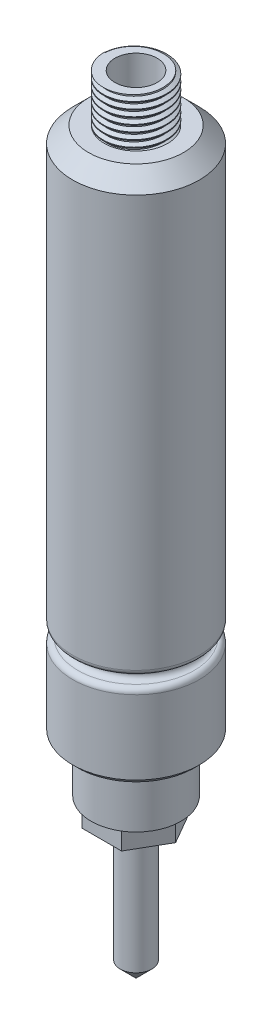
from build123d import *

# Parameters (mm, degrees)
SKETCH1_R           = 12
BOSS_EXTRUDE1_DEPTH = 90
SKETCH2_R           = 12
SKETCH2_R_2         = 8.5
CUT_EXTRUDE1_DEPTH  = 10
SKETCH3_W           = 2
SKETCH3_H           = 2
SKETCH4_R           = 12
BOSS_EXTRUDE2_DEPTH = 20
SKETCH5_R           = 3
BOSS_EXTRUDE3_DEPTH = 30
CHAMFER1_SIZE       = 3
SKETCH6_R           = 6
BOSS_EXTRUDE4_DEPTH = 10
THREAD1_PITCH       = 1.25
CUT_EXTRUDE2_START  = -1
SKETCH15_R          = 6
CUT_EXTRUDE2_DEPTH  = 1
CHAMFER2_SIZE       = 1
SKETCH16_R          = 3
BOSS_EXTRUDE5_DEPTH = 4
FILLET1_R           = 1
FILLET2_R           = 1
SKETCH17_R          = 4
CUT_EXTRUDE3_DEPTH  = 119
FILLET3_R           = 3
SKETCH18_R          = 0.13
CUT_EXTRUDE4_DEPTH  = 50
CUT_EXTRUDE5_START  = -18
SKETCH20_R          = 0.13
CUT_EXTRUDE5_DEPTH  = 18
CUT_EXTRUDE6_START  = -60
CUT_EXTRUDE6_DEPTH  = 60
BOSS_EXTRUDE6_START = -20
BOSS_EXTRUDE6_DEPTH = 20
CHAMFER3_SIZE       = 3


with BuildPart() as part:
    # Sketch1 → Boss-Extrude1 (new body)
    with BuildSketch(Plane(origin=(0, 0, 0), x_dir=(1, 0, 0), z_dir=(0, 1, 0))):
        with Locations(Location((0, 0, 0), (0, 0, 90))):
            Circle(SKETCH1_R)
    extrude(amount=BOSS_EXTRUDE1_DEPTH)

    # Sketch2 → Cut-Extrude1 (cut)
    with BuildSketch(Plane.XZ):
        with Locations(Location((0, 0, 0), (0, 0, 270))):
            Circle(SKETCH2_R)
        with Locations(Location((0, 0, 0), (0, 0, 270))):
            Circle(SKETCH2_R_2, mode=Mode.SUBTRACT)
    extrude(amount=-CUT_EXTRUDE1_DEPTH, mode=Mode.SUBTRACT)

    # Sketch3 → Cut-Revolve1 (revolve, cut)
    with BuildSketch(Plane(origin=(0, 0, 0), x_dir=(0, 0, -1), z_dir=(1, 0, 0)), mode=Mode.PRIVATE) as cut_revolve1_sk:
        with Locations((-11, 27)):
            Rectangle(SKETCH3_W, SKETCH3_H)
    revolve(cut_revolve1_sk.sketch.rotate(Axis((0, 90, 0), (0, -1, 0)), 180), axis=Axis((0, 90, 0), (0, -1, 0)), mode=Mode.SUBTRACT)

    # Sketch4 → Boss-Extrude2 (add)
    with BuildSketch(Plane(origin=(0, 90, 0), x_dir=(1, 0, 0), z_dir=(0, 1, 0))):
        with Locations(Location((0, 0, 0), (0, 0, 90))):
            Circle(SKETCH4_R)
    extrude(amount=BOSS_EXTRUDE2_DEPTH)

    # Sketch5 → Boss-Extrude3 (add)
    with BuildSketch(Plane.XZ):
        with Locations(Location((0, 0, 0), (0, 0, 270))):
            Circle(SKETCH5_R)
    extrude(amount=BOSS_EXTRUDE3_DEPTH)

    # Chamfer1
    chamfer1_edges = [part.edges().sort_by_distance(p)[0] for p in [
        (0, -30, 3),
    ]]
    chamfer(chamfer1_edges, length=CHAMFER1_SIZE)

    # Sketch6 → Boss-Extrude4 (add)
    with BuildSketch(Plane(origin=(0, 110, 0), x_dir=(1, 0, 0), z_dir=(0, 1, 0))):
        with Locations(Location((0, 0, 0), (0, 0, 270))):
            Circle(SKETCH6_R)
    extrude(amount=BOSS_EXTRUDE4_DEPTH)

    # Thread1: the profile of Thread Profile2 profile screwed along a right-hand helix of 8 turns, 8 arcs to a turn; built about Z, then put on its axis
    thread1_z = Axis((0, 0, 0), (0, 0, 1))
    thread1_corners = [(6.0003, 0, -0.000173205), (6.0003, 0, 1.093923202), (5.323417656, 0, 0.703124998), (5.323417656, 0, 0.390624998)]
    with BuildLine(mode=Mode.PRIVATE) as thread1_profile:
        Line(thread1_corners[0], thread1_corners[1])
        Line(thread1_corners[1], thread1_corners[2])
        Line(thread1_corners[2], thread1_corners[3])
        Line(thread1_corners[3], thread1_corners[0])
    thread1_cap = Face(thread1_profile.wire())
    thread1_turn_angles = [0, 22.5, 45, 67.5, 90, 112.5, 135, 157.5, 180, 202.5, 225, 247.5, 270, 292.5, 315, 337.5, 360]
    thread1_turn_weights = [1, 0.9238795325112867, 1, 0.9238795325112867, 1, 0.9238795325112867, 1, 0.9238795325112867, 1, 0.9238795325112867, 1, 0.9238795325112867, 1, 0.9238795325112867, 1, 0.9238795325112867, 1]
    thread1_turn_rails = [Edge.make_bspline([Vector(p[0], p[1], 0).rotate(thread1_z, thread1_turn_angles[k]) / thread1_turn_weights[k] + Vector(0, 0, p[2] + THREAD1_PITCH * thread1_turn_angles[k] / 360) for k in range(17)], [0, 0, 0, 1, 1, 2, 2, 3, 3, 4, 4, 5, 5, 6, 6, 7, 7, 8, 8, 8], 2, thread1_turn_weights) for p in thread1_corners]
    thread1_turn_sides = [Face.make_surface_from_curves(thread1_turn_rails[p[0]], thread1_turn_rails[p[1]]) for p in [(0, 1), (1, 2), (2, 3), (3, 0)]]
    thread1 = Plane(origin=(0, 120, 0), x_dir=(-1, 0, 0), z_dir=(0, -1, 0)) * Solid(Shell([*[p.moved(Location((0, 0, THREAD1_PITCH * i))) for i in range(8) for p in thread1_turn_sides], thread1_cap, thread1_cap.rotate(thread1_z, 2880).moved(Location((0, 0, THREAD1_PITCH * 2880 / 360)))]))
    add(thread1, mode=Mode.SUBTRACT)

    # Sketch15 → Cut-Extrude2 (cut)
    with BuildSketch(Plane(origin=(0, 120, 0), x_dir=(1, 0, 0), z_dir=(0, 1, 0)).offset(CUT_EXTRUDE2_START)):
        Circle(SKETCH15_R)
    extrude(amount=CUT_EXTRUDE2_DEPTH, mode=Mode.SUBTRACT)

    # Chamfer2
    chamfer2_edges = [part.edges().sort_by_distance(p)[0] for p in [
        (0, 10, 12),
    ]]
    chamfer(chamfer2_edges, length=CHAMFER2_SIZE)

    # Sketch16 → Boss-Extrude5 (add)
    with BuildSketch(Plane.XZ):
        Polygon((-3.75, -6.495190528), (3.75, -6.495190528), (7.5, 0), (3.75, 6.495190528), (-3.75, 6.495190528), (-7.5, 0), align=None)
        with Locations(Location((0, 0, 0), (0, 0, 270))):
            Circle(SKETCH16_R, mode=Mode.SUBTRACT)
    extrude(amount=BOSS_EXTRUDE5_DEPTH)

    # Fillet1
    fillet1_edges = [part.edges().sort_by_distance(p)[0] for p in [
        (0, 26, 10),
        (0, 28, 10),
    ]]
    fillet(fillet1_edges, radius=FILLET1_R - 0.0001)  # a hair under: the kernel refuses the full size

    # Fillet2
    fillet2_edges = [part.edges().sort_by_distance(p)[0] for p in [
        (0, 28, 12),
        (0, 26, 12),
    ]]
    fillet(fillet2_edges, radius=FILLET2_R)

    # Sketch17 → Cut-Extrude3 (cut)
    with BuildSketch(Plane(origin=(0, 119, 0), x_dir=(1, 0, 0), z_dir=(0, 1, 0))):
        with Locations(Location((0, 0, 0), (0, 0, 270))):
            Circle(SKETCH17_R)
    extrude(amount=-CUT_EXTRUDE3_DEPTH, mode=Mode.SUBTRACT)

    # Fillet3
    fillet3_edges = [part.edges().sort_by_distance(p)[0] for p in [
        (0, 0, -4),
    ]]
    fillet(fillet3_edges, radius=FILLET3_R)

    # Sketch18 → Cut-Extrude4 (cut)
    with BuildSketch(Plane.XZ.offset(4)):
        with Locations(Location((0, 0, 0), (0, 0, 90))):
            Circle(SKETCH18_R)
    extrude(amount=CUT_EXTRUDE4_DEPTH, mode=Mode.SUBTRACT)

    # Sketch20 → Cut-Extrude5 (cut)
    with BuildSketch(Plane.XZ.offset(4).offset(CUT_EXTRUDE5_START)):
        with Locations(Location((0, 0, 0), (0, 0, 90))):
            Circle(SKETCH20_R)
    extrude(amount=CUT_EXTRUDE5_DEPTH, mode=Mode.SUBTRACT)

    # Sketch21 → Cut-Extrude6 (cut)
    with BuildSketch(Plane(origin=(0, 110, 0), x_dir=(1, 0, 0), z_dir=(0, 1, 0)).offset(CUT_EXTRUDE6_START)):
        with BuildLine():
            ThreePointArc((-10, 6.633249581), (-11.489125293, 3.464101615), (-12, 0))
            Line((-12, 0), (-10, 0))
            Line((-10, 0), (-10, 6.633249581))
        make_face()
        with BuildLine():
            Line((-10, 0), (-12, 0))
            ThreePointArc((-12, 0), (-11.489125293, -3.464101615), (-10, -6.633249581))
            Line((-10, -6.633249581), (-10, 0))
        make_face()
    extrude(amount=CUT_EXTRUDE6_DEPTH, mode=Mode.SUBTRACT)

    # Sketch21<3> → Boss-Extrude6 (add)
    with BuildSketch(Plane(origin=(0, 110, 0), x_dir=(1, 0, 0), z_dir=(0, 1, 0)).offset(BOSS_EXTRUDE6_START)):
        with BuildLine():
            ThreePointArc((-10, 6.633249581), (-11.489125293, 3.464101615), (-12, 0))
            Line((-12, 0), (-10, 0))
            Line((-10, 0), (-10, 6.633249581))
        make_face()
        with BuildLine():
            Line((-10, 0), (-12, 0))
            ThreePointArc((-12, 0), (-11.489125293, -3.464101615), (-10, -6.633249581))
            Line((-10, -6.633249581), (-10, 0))
        make_face()
    extrude(amount=BOSS_EXTRUDE6_DEPTH)

    # Chamfer3
    chamfer3_edges = [part.edges().sort_by_distance(p)[0] for p in [
        (0, 110, 12),
    ]]
    chamfer(chamfer3_edges, length=CHAMFER3_SIZE)


solid = part.part
